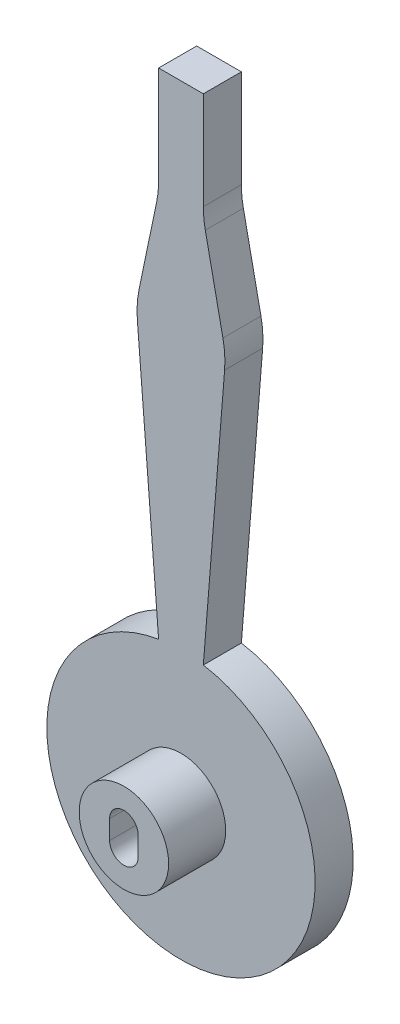
from build123d import *

# Parameters (mm, degrees)
SKETCH1_R           = 4.7
BOSS_EXTRUDE1_DEPTH = 4
SKETCH1_3_R         = 4.7
BOSS_EXTRUDE2_DEPTH = 10
CUT_EXTRUDE1_DEPTH  = 3


with BuildPart() as part:
    # Sketch1 → Boss-Extrude1 (new body)
    with BuildSketch(Plane.XY):
        with BuildLine():
            Line((2.35, 13.90278749), (4.585741176, 41.864603012))
            ThreePointArc((4.585741176, 41.864603012), (4.597967377, 43.28721197), (4.408193437, 44.697159337))
            Line((4.408193437, 44.697159337), (2.559360842, 53.589805153))
            ThreePointArc((2.559360842, 53.589805153), (2.402477907, 54.602201264), (2.35, 55.625335767))
            Line((2.35, 55.625335767), (2.35, 65.9))
            Line((2.35, 65.9), (-2.35, 65.9))
            Line((-2.35, 65.9), (-2.35, 55.625335767))
            ThreePointArc((-2.35, 55.625335767), (-2.402477907, 54.602201264), (-2.559360842, 53.589805153))
            Line((-2.559360842, 53.589805153), (-4.408193437, 44.697159337))
            ThreePointArc((-4.408193437, 44.697159337), (-4.597967377, 43.28721197), (-4.585741176, 41.864603012))
            Line((-4.585741176, 41.864603012), (-2.35, 13.90278749))
            ThreePointArc((-2.35, 13.90278749), (0, -14.1), (2.35, 13.90278749))
        make_face()
        Circle(SKETCH1_R, mode=Mode.SUBTRACT)
    extrude(amount=BOSS_EXTRUDE1_DEPTH)

    # Sketch1<3> → Boss-Extrude2 (add)
    with BuildSketch(Plane.XY):
        Circle(SKETCH1_3_R)
    extrude(amount=BOSS_EXTRUDE2_DEPTH)

    # Sketch2 → Cut-Extrude1 (cut)
    with BuildSketch(Plane.XY.offset(10)):
        with BuildLine():
            Line((1.5, 1), (1.5, -1))
            ThreePointArc((1.5, -1), (0, -2.5), (-1.5, -1))
            Line((-1.5, -1), (-1.5, 1))
            ThreePointArc((-1.5, 1), (0, 2.5), (1.5, 1))
        make_face()
    extrude(amount=-CUT_EXTRUDE1_DEPTH, mode=Mode.SUBTRACT)


solid = part.part
